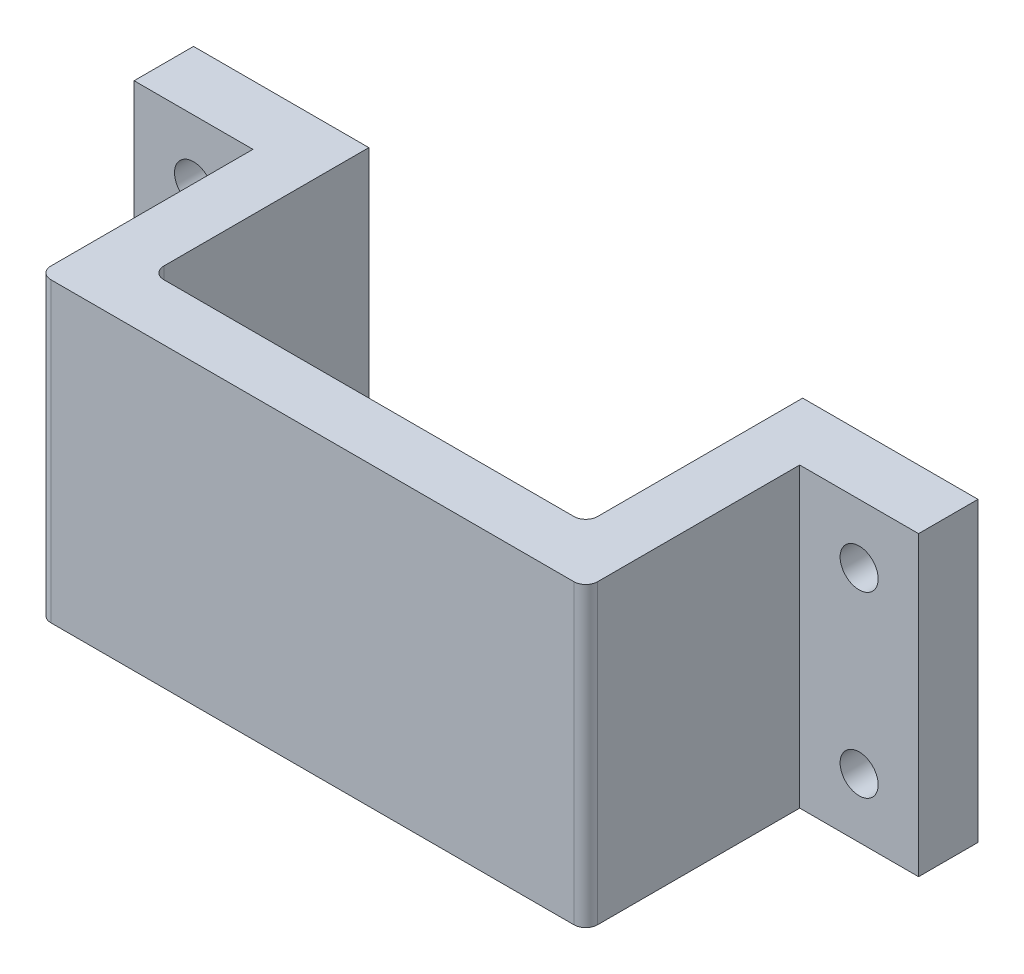
from build123d import *

# Parameters (mm, degrees)
EXTRUDE_1_DEPTH     = 25
SKETCH_2_W          = 10
SKETCH_2_H          = 25
EXTRUDE_2_DEPTH     = 5
FILLET_1_R          = 1
SKETCH_3_R          = 1.6
CUT_EXTRUDE_1_DEPTH = 66.498091575
FILLET_2_R          = 1


with BuildPart() as part:
    # Эскиз1 → Бобышка-Вытянуть1 (new body)
    with BuildSketch(Plane(origin=(0, 0, 0), x_dir=(1, 0, 0), z_dir=(0, 1, 0))):
        Polygon((0, 0), (46, 0), (46, 23), (41.25, 23), (41.25, 4.75), (4.75, 4.75), (4.75, 23), (0, 23), align=None)
    extrude(amount=EXTRUDE_1_DEPTH)

    # Эскиз2 → Бобышка-Вытянуть2 (add)
    with BuildSketch(Plane(origin=(0, 0, -23), x_dir=(-1, 0, 0), z_dir=(0, 0, -1))):
        with Locations((-51, 12.5)):
            Rectangle(SKETCH_2_W, SKETCH_2_H)
        with Locations((5, 12.5)):
            Rectangle(SKETCH_2_W, SKETCH_2_H)
    extrude(amount=-EXTRUDE_2_DEPTH)

    # Скругление1
    fillet_1_edges = [part.edges().sort_by_distance(p)[0] for p in [
        (41.25, 12.5, -4.75),
        (4.75, 12.5, -4.75),
    ]]
    fillet(fillet_1_edges, radius=FILLET_1_R)

    # Эскиз3 → Вырез-Вытянуть1 (cut, through all)
    with BuildSketch(Plane(origin=(0, 0, -23), x_dir=(-1, 0, 0), z_dir=(0, 0, -1))):
        with Locations((5, 20)):
            Circle(SKETCH_3_R)
        with Locations((5, 5)):
            Circle(SKETCH_3_R)
        with Locations((-51, 20)):
            Circle(SKETCH_3_R)
        with Locations((-51, 5)):
            Circle(SKETCH_3_R)
    extrude(amount=-CUT_EXTRUDE_1_DEPTH, mode=Mode.SUBTRACT)

    # Скругление2
    fillet_2_edges = [part.edges().sort_by_distance(p)[0] for p in [
        (0, 12.5, 0),
        (46, 12.5, 0),
    ]]
    fillet(fillet_2_edges, radius=FILLET_2_R)


solid = part.part
